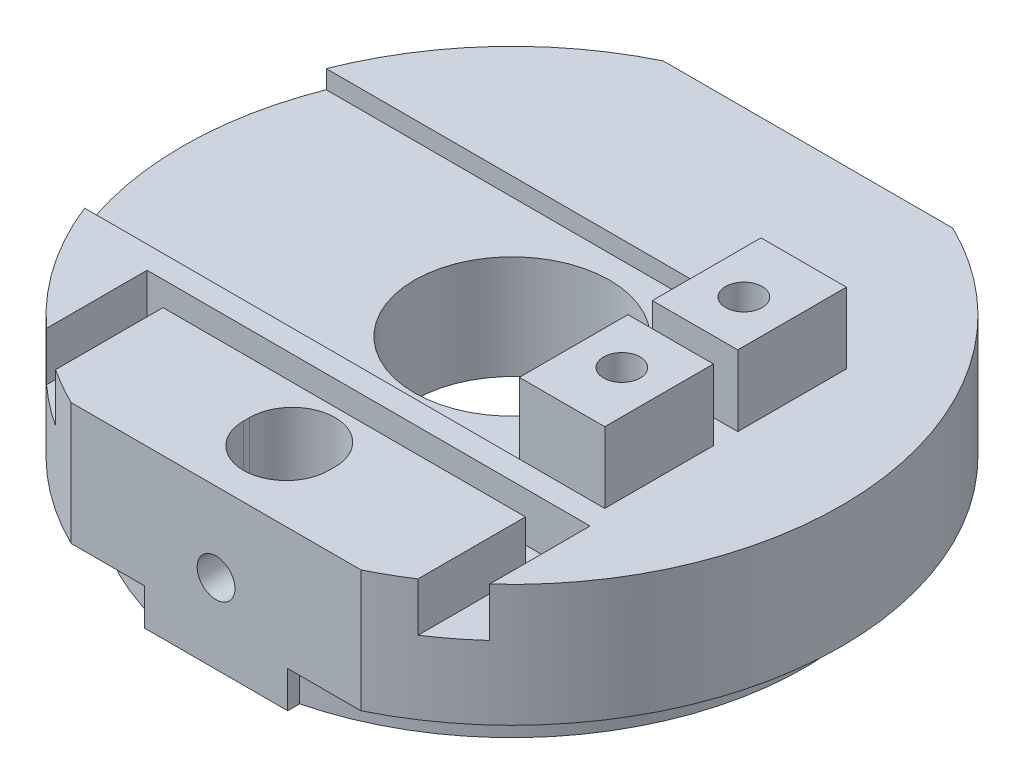
from build123d import *

# Parameters (mm, degrees)
SKETCH1_R           = 8
BOSS_EXTRUDE1_DEPTH = 10
SKETCH1_3_R         = 22
BOSS_EXTRUDE2_DEPTH = 3
CUT_EXTRUDE1_DEPTH  = 4
SKETCH3_W           = 37.5
SKETCH3_H           = 19.8
CUT_EXTRUDE2_DEPTH  = 1.5
SKETCH4_W           = 7
SKETCH4_H           = 8.9
SKETCH4_R           = 1.5
BOSS_EXTRUDE3_DEPTH = 5.8
SKETCH5_R           = 1.55
CUT_EXTRUDE3_DEPTH  = 6


with BuildPart() as part:
    # Sketch1 → Boss-Extrude1 (new body)
    with BuildSketch(Plane(origin=(0, 0, 0), x_dir=(1, 0, 0), z_dir=(0, 1, 0))):
        with BuildLine():
            ThreePointArc((-11.871710071, 24.25), (-27, 0), (-11.871710071, -24.25))
            Line((-11.871710071, -24.25), (11.871710071, -24.25))
            ThreePointArc((11.871710071, -24.25), (27, 0), (11.871710071, 24.25))
            Line((11.871710071, 24.25), (-11.871710071, 24.25))
        make_face()
        with BuildLine():
            ThreePointArc((-3.5, -18), (0, -14.5), (3.5, -18))
            Line((3.5, -18), (3.5, -18.5))
            ThreePointArc((3.5, -18.5), (0, -22), (-3.5, -18.5))
            Line((-3.5, -18.5), (-3.5, -18))
        make_face(mode=Mode.SUBTRACT)
        Circle(SKETCH1_R, mode=Mode.SUBTRACT)
    extrude(amount=BOSS_EXTRUDE1_DEPTH)

    # Sketch1<3> → Boss-Extrude2 (add)
    with BuildSketch(Plane(origin=(0, 0, 0), x_dir=(1, 0, 0), z_dir=(0, 1, 0))):
        with BuildLine():
            Line((-5.874521255, -23.269937688), (-5.874521255, -24.25))
            Line((-5.874521255, -24.25), (5.874521255, -24.25))
            Line((5.874521255, -24.25), (5.874521255, -23.269937688))
            ThreePointArc((5.874521255, -23.269937688), (0, 24), (-5.874521255, -23.269937688))
        make_face()
        Circle(SKETCH1_3_R, mode=Mode.SUBTRACT)
    extrude(amount=-BOSS_EXTRUDE2_DEPTH)

    # Sketch2 → Cut-Extrude1 (cut)
    with BuildSketch(Plane(origin=(0, 10, 0), x_dir=(1, 0, 0), z_dir=(0, 1, 0))):
        Polygon((-18.15, -11.75), (-18.15, -24.25), (-14.85, -24.25), (-14.85, -13.75), (14.85, -13.75), (14.85, -24.25), (18.15, -24.25), (18.15, -11.75), align=None)
    extrude(amount=-CUT_EXTRUDE1_DEPTH, mode=Mode.SUBTRACT)

    # Sketch3 → Cut-Extrude2 (cut)
    with BuildSketch(Plane(origin=(0, 10, 0), x_dir=(1, 0, 0), z_dir=(0, 1, 0))):
        with Locations((-8.25, 0)):
            Rectangle(SKETCH3_W, SKETCH3_H)
    extrude(amount=-CUT_EXTRUDE2_DEPTH, mode=Mode.SUBTRACT)

    # Sketch4 → Boss-Extrude3 (add)
    # profile 1 of 2: a face of its own
    with BuildSketch(Plane(origin=(0, 10, 0), x_dir=(1, 0, 0), z_dir=(0, 1, 0))):
        with Locations((14, 5.45)):
            Rectangle(SKETCH4_W, SKETCH4_H)
        with Locations((14, 5)):
            Circle(SKETCH4_R, mode=Mode.SUBTRACT)
    # profile 2 of 2: a face of its own
    with BuildSketch(Plane(origin=(0, 10, 0), x_dir=(1, 0, 0), z_dir=(0, 1, 0))):
        with Locations((14, -5.45)):
            Rectangle(SKETCH4_W, SKETCH4_H)
        with Locations((14, -5)):
            Circle(SKETCH4_R, mode=Mode.SUBTRACT)
    extrude(amount=BOSS_EXTRUDE3_DEPTH)

    # Sketch5 → Cut-Extrude3 (cut)
    with BuildSketch(Plane.XY.offset(24.25)):
        with Locations((0, 3.5)):
            Circle(SKETCH5_R)
    extrude(amount=-CUT_EXTRUDE3_DEPTH, mode=Mode.SUBTRACT)


solid = part.part
